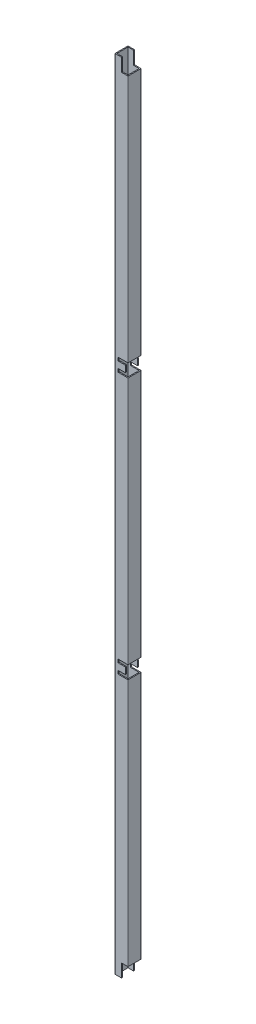
from build123d import *

# Parameters (mm, degrees)
SKETCH1_W                   = 17
SKETCH1_H                   = 17
BOSS_EXTRUDE1_DEPTH         = 1220
SKETCH2_W                   = 20
SKETCH2_H                   = 20
CUT_EXTRUDE1_DEPTH          = 10
CUT_EXTRUDE2_DEPTH          = 15
SKETCH4_W                   = 3
SKETCH4_H                   = 10
CUT_EXTRUDE3_DEPTH          = 10
SKETCH_PATTERN1_START       = -20
SKETCH_PATTERN1_DEPTH       = 15
SKETCH_PATTERN1_2_OUTLINE_W = 1.5
SKETCH_PATTERN1_2_OUTLINE_H = 10
SKETCH_PATTERN1_2_DEPTH     = 3
SKETCH6_W                   = 20
SKETCH6_H                   = 20
CUT_EXTRUDE4_DEPTH          = 4
SKETCH7_W                   = 11
SKETCH7_H                   = 5
CUT_EXTRUDE5_DEPTH          = 1221.327824808
LPATTERN1_COUNT             = 2
LPATTERN1_PITCH             = 400


# Read off the part's stored shape, not the designer's step: Sketch-Pattern1
with BuildPart() as part:
    # Sketch1 → Boss-Extrude1 (new body)
    with BuildSketch(Plane(origin=(0, 0, 0), x_dir=(1, 0, 0), z_dir=(0, 1, 0))):
        with BuildLine():
            Line((0.5, 0), (19.5, 0))
            ThreePointArc((19.5, 0), (19.853553391, 0.146446609), (20, 0.5))
            Line((20, 0.5), (20, 19.5))
            ThreePointArc((20, 19.5), (19.853553391, 19.853553391), (19.5, 20))
            Line((19.5, 20), (0.5, 20))
            ThreePointArc((0.5, 20), (0.146446609, 19.853553391), (0, 19.5))
            Line((0, 19.5), (0, 0.5))
            ThreePointArc((0, 0.5), (0.146446609, 0.146446609), (0.5, 0))
        make_face()
        with Locations((10, 10)):
            Rectangle(SKETCH1_W, SKETCH1_H, mode=Mode.SUBTRACT)
    extrude(amount=BOSS_EXTRUDE1_DEPTH)

    # Sketch2 → Cut-Extrude1 (cut)
    with BuildSketch(Plane(origin=(20, 0, 0), x_dir=(0, 0, -1), z_dir=(1, 0, 0))):
        with Locations((10, 1210)):
            Rectangle(SKETCH2_W, SKETCH2_H)
        with Locations((10, 10)):
            Rectangle(SKETCH2_W, SKETCH2_H)
    extrude(amount=-CUT_EXTRUDE1_DEPTH, mode=Mode.SUBTRACT)

    # Sketch3 → Cut-Extrude2 (cut)
    with BuildSketch(Plane(origin=(0, 0, -20), x_dir=(-1, 0, 0), z_dir=(0, 0, -1))):
        Polygon((-15, 1115), (0, 1115), (0, 1120), (-9, 1120), (-9, 1130), (0, 1130), (0, 1135), (-15, 1135), align=None)
    extrude(amount=-CUT_EXTRUDE2_DEPTH, mode=Mode.SUBTRACT)

    # Sketch4 → Cut-Extrude3 (cut)
    with BuildSketch(Plane.ZY):
        with Locations((-18.5, 1125)):
            Rectangle(SKETCH4_W, SKETCH4_H)
    extrude(amount=-CUT_EXTRUDE3_DEPTH, mode=Mode.SUBTRACT)

    # Sketch-Pattern1 outline → Sketch-Pattern1 (cut)
    with BuildSketch(Plane.XY.offset(SKETCH_PATTERN1_START)):
        Polygon((15, 85), (15, 105), (0, 105), (0, 100), (1.5, 100), (1.5, 90), (0, 90), (0, 85), align=None)
        Polygon((1.5, 330), (1.5, 320), (0, 320), (0, 315), (15, 315), (15, 335), (0, 335), (0, 330), align=None)
        Polygon((1.5, 500), (1.5, 490), (0, 490), (0, 485), (15, 485), (15, 505), (0, 505), (0, 500), align=None)
        Polygon((1.5, 730), (1.5, 720), (0, 720), (0, 715), (15, 715), (15, 735), (0, 735), (0, 730), align=None)
        Polygon((1.5, 900), (1.5, 890), (0, 890), (0, 885), (15, 885), (15, 905), (0, 905), (0, 900), align=None)
    extrude(amount=SKETCH_PATTERN1_DEPTH, mode=Mode.SUBTRACT)

    # Sketch-Pattern1 2 outline → Sketch-Pattern1 2 (cut)
    with BuildSketch(Plane.XY.offset(SKETCH_PATTERN1_START)):
        with Locations((0.75, 95)):
            Rectangle(SKETCH_PATTERN1_2_OUTLINE_W, SKETCH_PATTERN1_2_OUTLINE_H)
        with Locations((0.75, 325)):
            Rectangle(SKETCH_PATTERN1_2_OUTLINE_W, SKETCH_PATTERN1_2_OUTLINE_H)
        with Locations((0.75, 495)):
            Rectangle(SKETCH_PATTERN1_2_OUTLINE_W, SKETCH_PATTERN1_2_OUTLINE_H)
        with Locations((0.75, 725)):
            Rectangle(SKETCH_PATTERN1_2_OUTLINE_W, SKETCH_PATTERN1_2_OUTLINE_H)
        with Locations((0.75, 895)):
            Rectangle(SKETCH_PATTERN1_2_OUTLINE_W, SKETCH_PATTERN1_2_OUTLINE_H)
    extrude(amount=SKETCH_PATTERN1_2_DEPTH, mode=Mode.SUBTRACT)

    # Sketch6 → Cut-Extrude4 (cut)
    with BuildSketch(Plane(origin=(20, 0, 0), x_dir=(0, 0, -1), z_dir=(1, 0, 0))):
        with Locations((10, 810)):
            Rectangle(SKETCH6_W, SKETCH6_H)
    cut_extrude4 = extrude(amount=-CUT_EXTRUDE4_DEPTH, mode=Mode.SUBTRACT)

    # Sketch7 → Cut-Extrude5 (cut, symmetric)
    with BuildSketch(Plane(origin=(0, 0, -20), x_dir=(-1, 0, 0), z_dir=(0, 0, -1))):
        with Locations((-10.5, 817.5)):
            Rectangle(SKETCH7_W, SKETCH7_H)
        with Locations((-10.5, 802.5)):
            Rectangle(SKETCH7_W, SKETCH7_H)
    cut_extrude5 = extrude(amount=CUT_EXTRUDE5_DEPTH, both=True, mode=Mode.SUBTRACT)

    # LPattern1: Cut-Extrude4, Cut-Extrude5 ×2
    with Locations(*[(0, -i * LPATTERN1_PITCH, 0) for i in range(1, LPATTERN1_COUNT)]):
        add(cut_extrude4, mode=Mode.SUBTRACT)
        add(cut_extrude5, mode=Mode.SUBTRACT)


solid = part.part
